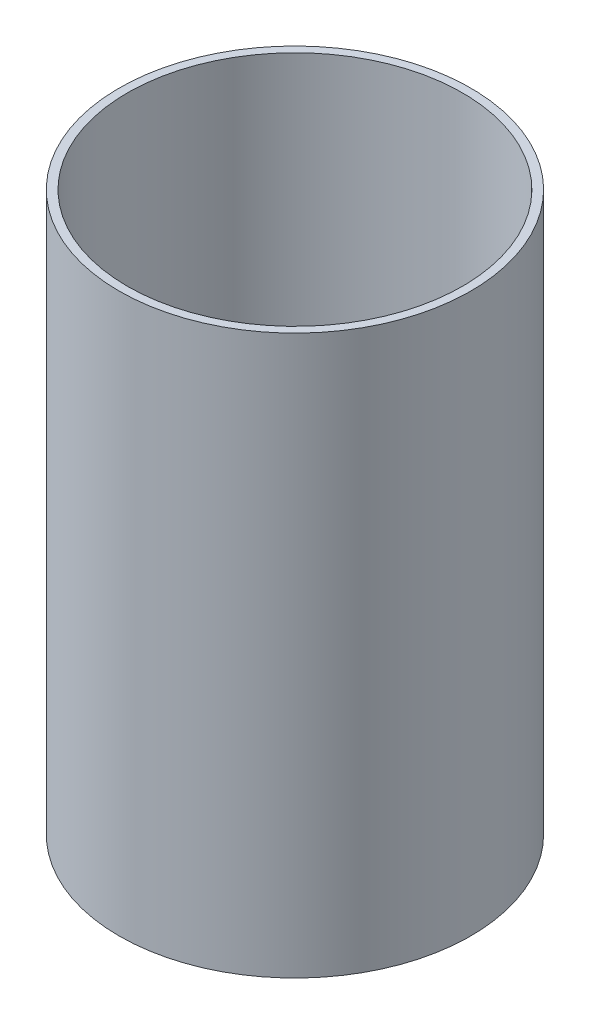
from build123d import *

# Parameters (mm, degrees)
SKETCH1_R           = 85
SKETCH1_R_2         = 81
BOSS_EXTRUDE1_DEPTH = 270


with BuildPart() as part:
    # Sketch1 → Boss-Extrude1 (new body)
    with BuildSketch(Plane(origin=(0, 0, 0), x_dir=(1, 0, 0), z_dir=(0, 1, 0))):
        Circle(SKETCH1_R)
        Circle(SKETCH1_R_2, mode=Mode.SUBTRACT)
    extrude(amount=BOSS_EXTRUDE1_DEPTH)


solid = part.part
